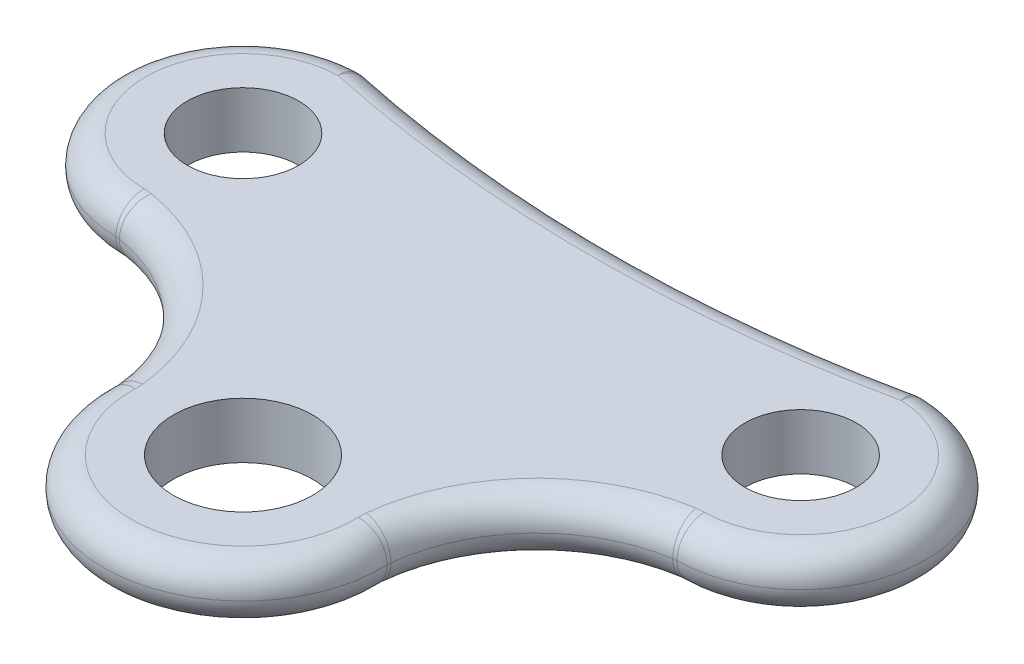
from build123d import *

# Parameters (mm, degrees)
SKETCH1_R           = 5
SKETCH1_R_2         = 4
BOSS_EXTRUDE1_DEPTH = 4
FILLET1_R           = 2


with BuildPart() as part:
    # Sketch1 → Boss-Extrude1 (new body)
    with BuildSketch(Plane(origin=(0, 0, 0), x_dir=(1, 0, 0), z_dir=(0, 1, 0))):
        with BuildLine():
            ThreePointArc((-20, 29), (-29, 20), (-20, 11))
            ThreePointArc((-20, 11), (-13.164114328, 7.468842596), (-9.989400339, 0.460305187))
            ThreePointArc((-9.989400339, 0.460305187), (0, -10), (9.989400339, 0.460305187))
            ThreePointArc((9.989400339, 0.460305187), (13.164114328, 7.468842596), (20, 11))
            ThreePointArc((20, 11), (29, 20), (20, 29))
            ThreePointArc((20, 29), (0, 26.863188813), (-20, 29))
        make_face()
        with Locations(Location((0, 0, 0), (0, 0, 270))):
            Circle(SKETCH1_R, mode=Mode.SUBTRACT)
        with Locations(Location((-20, 20, 0), (0, 0, 270))):
            Circle(SKETCH1_R_2, mode=Mode.SUBTRACT)
        with Locations(Location((20, 20, 0), (0, 0, 270))):
            Circle(SKETCH1_R_2, mode=Mode.SUBTRACT)
    extrude(amount=BOSS_EXTRUDE1_DEPTH)

    # Fillet1
    fillet1_edges = [part.edges().sort_by_distance(p)[0] for p in [
        (13.164114328, 4, -7.468842596),
        (-20, 2, -11),
        (-20, 2, -29),
        (20, 2, -29),
        (20, 2, -11),
        (9.989400339, 2, -0.460305187),
        (-9.989400339, 2, -0.460305187),
        (29, 4, -20),
        (0, 4, -26.863188813),
        (-29, 4, -20),
        (-13.164114328, 4, -7.468842596),
        (-29, 0, -20),
        (0, 0, -26.863188813),
        (29, 0, -20),
        (0, 4, 10),
        (13.164114328, 0, -7.468842596),
        (0, 0, 10),
        (-13.164114328, 0, -7.468842596),
    ]]
    fillet(fillet1_edges, radius=FILLET1_R - 0.0001)  # a hair under: the kernel refuses the full size


solid = part.part
